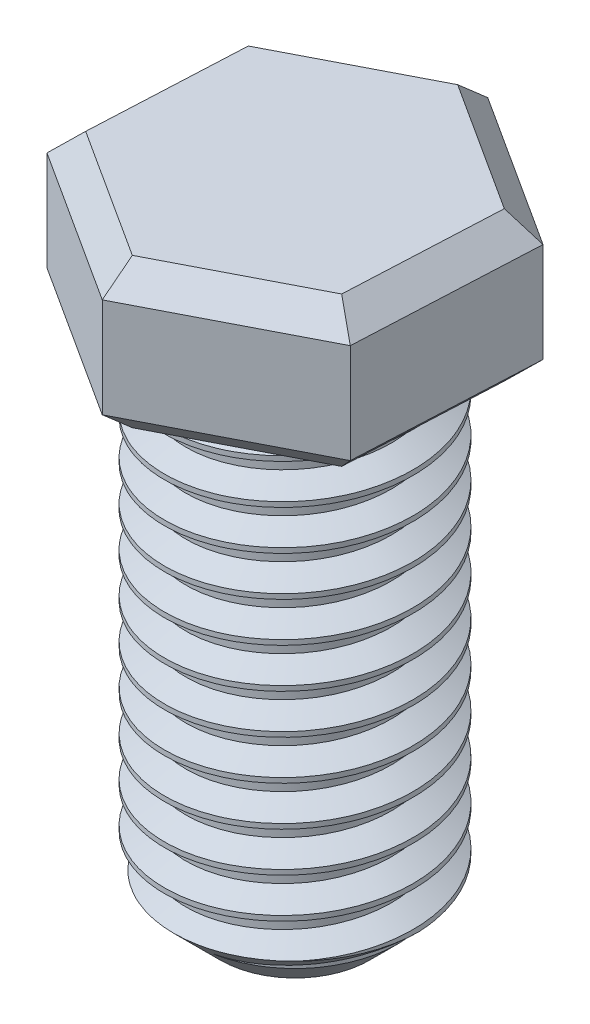
from build123d import *

# Parameters (mm, degrees)
SKETCH1_R           = 2.5
BOSS_EXTRUDE1_DEPTH = 10
CHAMFER2_SIZE       = 1
THREAD1_PITCH       = 0.8
BOSS_EXTRUDE2_DEPTH = 3
CHAMFER1_SIZE       = 0.5


with BuildPart() as part:
    # Sketch1 → Boss-Extrude1 (new body)
    with BuildSketch(Plane(origin=(0, 0, 0), x_dir=(1, 0, 0), z_dir=(0, 1, 0))):
        with Locations(Location((0, 0, 0), (0, 0, 270))):
            Circle(SKETCH1_R)
    extrude(amount=BOSS_EXTRUDE1_DEPTH)

    # Chamfer2
    chamfer2_edges = [part.edges().sort_by_distance(p)[0] for p in [
        (0, 0, -2.5),
    ]]
    chamfer(chamfer2_edges, length=CHAMFER2_SIZE)

    # Thread1: the profile of Thread Profile1 profile screwed along a right-hand helix of 15 turns, 8 arcs to a turn; built about Z, then put on its axis
    thread1_z = Axis((0, 0, 0), (0, 0, 1))
    thread1_corners = [(2.5003, 0, -0.000173205), (2.5003, 0, 0.700173203), (2.0669873, 0, 0.449999999), (2.0669873, 0, 0.249999999)]
    with BuildLine(mode=Mode.PRIVATE) as thread1_profile:
        Line(thread1_corners[0], thread1_corners[1])
        Line(thread1_corners[1], thread1_corners[2])
        Line(thread1_corners[2], thread1_corners[3])
        Line(thread1_corners[3], thread1_corners[0])
    thread1_cap = Face(thread1_profile.wire())
    thread1_turn_angles = [0, 22.5, 45, 67.5, 90, 112.5, 135, 157.5, 180, 202.5, 225, 247.5, 270, 292.5, 315, 337.5, 360]
    thread1_turn_weights = [1, 0.9238795325112867, 1, 0.9238795325112867, 1, 0.9238795325112867, 1, 0.9238795325112867, 1, 0.9238795325112867, 1, 0.9238795325112867, 1, 0.9238795325112867, 1, 0.9238795325112867, 1]
    thread1_turn_rails = [Edge.make_bspline([Vector(p[0], p[1], 0).rotate(thread1_z, thread1_turn_angles[k]) / thread1_turn_weights[k] + Vector(0, 0, p[2] + THREAD1_PITCH * thread1_turn_angles[k] / 360) for k in range(17)], [0, 0, 0, 1, 1, 2, 2, 3, 3, 4, 4, 5, 5, 6, 6, 7, 7, 8, 8, 8], 2, thread1_turn_weights) for p in thread1_corners]
    thread1_turn_sides = [Face.make_surface_from_curves(thread1_turn_rails[p[0]], thread1_turn_rails[p[1]]) for p in [(0, 1), (1, 2), (2, 3), (3, 0)]]
    thread1 = Plane(origin=(0, 11, 0), x_dir=(-1, 0, 0), z_dir=(0, -1, 0)) * Solid(Shell([*[p.moved(Location((0, 0, THREAD1_PITCH * i))) for i in range(15) for p in thread1_turn_sides], thread1_cap, thread1_cap.rotate(thread1_z, 5400).moved(Location((0, 0, THREAD1_PITCH * 5400 / 360)))]))
    add(thread1, mode=Mode.SUBTRACT)

    # Sketch4 → Boss-Extrude2 (add)
    with BuildSketch(Plane(origin=(0, 10, 0), x_dir=(1, 0, 0), z_dir=(0, 1, 0))):
        Polygon((0.176975212, 3.695765114), (-3.112138869, 2.001147586), (-3.289114081, -1.694617528), (-0.176975212, -3.695765114), (3.112138869, -2.001147586), (3.289114081, 1.694617528), align=None)
    extrude(amount=BOSS_EXTRUDE2_DEPTH)

    # Chamfer1
    chamfer1_edges = [part.edges().sort_by_distance(p)[0] for p in [
        (1.733044646, 10, -2.695191321),
        (-1.467581829, 10, -2.84845635),
        (-3.200626475, 10, -0.153265029),
        (-1.733044646, 10, 2.695191321),
        (1.467581829, 10, 2.84845635),
        (3.200626475, 10, 0.153265029),
        (1.733044646, 13, -2.695191321),
        (-1.467581829, 13, -2.84845635),
        (-3.200626475, 13, -0.153265029),
        (-1.733044646, 13, 2.695191321),
        (1.467581829, 13, 2.84845635),
        (3.200626475, 13, 0.153265029),
    ]]
    chamfer(chamfer1_edges, length=CHAMFER1_SIZE)


solid = part.part
